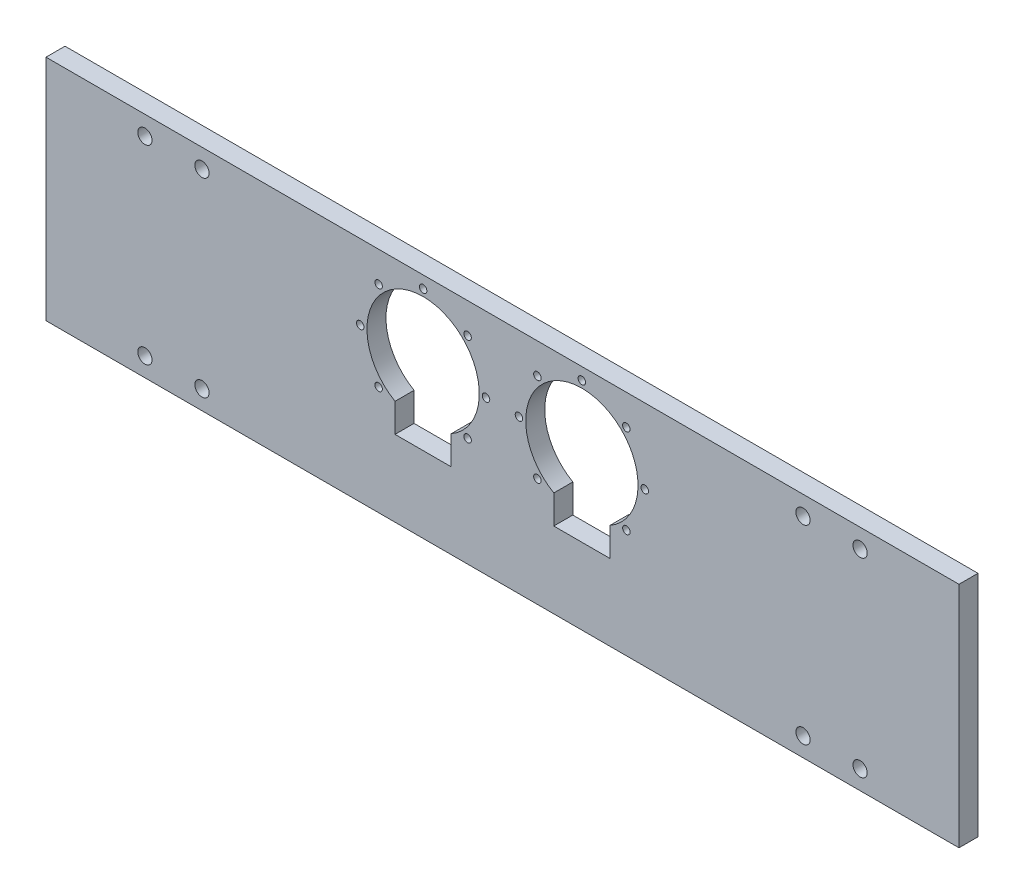
from build123d import *

# Parameters (mm, degrees)
SKETCH1_W           = 609.6
SKETCH1_H           = 152.4
SKETCH1_R           = 2.5
SKETCH1_R_2         = 4.7625
BOSS_EXTRUDE1_DEPTH = 12.7


with BuildPart() as part:
    # Sketch1 → Boss-Extrude1 (new body)
    with BuildSketch(Plane.XY):
        Rectangle(SKETCH1_W, SKETCH1_H)
        with Locations((53, 68.1999984)):
            Circle(SKETCH1_R, mode=Mode.SUBTRACT)
        with Locations((82.698486542, 55.898482492)):
            Circle(SKETCH1_R, mode=Mode.SUBTRACT)
        with Locations((95.00000245, 26.19999595)):
            Circle(SKETCH1_R, mode=Mode.SUBTRACT)
        with Locations((82.698486542, -3.498490592)):
            Circle(SKETCH1_R, mode=Mode.SUBTRACT)
        with Locations((23.301513458, -3.498490592)):
            Circle(SKETCH1_R, mode=Mode.SUBTRACT)
        with Locations((10.99999755, 26.19999595)):
            Circle(SKETCH1_R, mode=Mode.SUBTRACT)
        with Locations((23.301513458, 55.898482492)):
            Circle(SKETCH1_R, mode=Mode.SUBTRACT)
        with Locations((238.76, 63.5)):
            Circle(SKETCH1_R_2, mode=Mode.SUBTRACT)
        with Locations((200.66, 63.5)):
            Circle(SKETCH1_R_2, mode=Mode.SUBTRACT)
        with Locations((238.76, -63.5)):
            Circle(SKETCH1_R_2, mode=Mode.SUBTRACT)
        with Locations((200.66, -63.5)):
            Circle(SKETCH1_R_2, mode=Mode.SUBTRACT)
        with Locations((-82.698486542, -3.498490592)):
            Circle(SKETCH1_R, mode=Mode.SUBTRACT)
        with Locations((-95.00000245, 26.19999595)):
            Circle(SKETCH1_R, mode=Mode.SUBTRACT)
        with Locations((-82.698486542, 55.898482492)):
            Circle(SKETCH1_R, mode=Mode.SUBTRACT)
        with Locations((-53, 68.1999984)):
            Circle(SKETCH1_R, mode=Mode.SUBTRACT)
        with Locations((-23.301513458, 55.898482492)):
            Circle(SKETCH1_R, mode=Mode.SUBTRACT)
        with Locations((-10.99999755, 26.19999595)):
            Circle(SKETCH1_R, mode=Mode.SUBTRACT)
        with Locations((-23.301513458, -3.498490592)):
            Circle(SKETCH1_R, mode=Mode.SUBTRACT)
        with Locations((-238.76, 63.5)):
            Circle(SKETCH1_R_2, mode=Mode.SUBTRACT)
        with Locations((-200.66, 63.5)):
            Circle(SKETCH1_R_2, mode=Mode.SUBTRACT)
        with Locations((-200.66, -63.5)):
            Circle(SKETCH1_R_2, mode=Mode.SUBTRACT)
        with Locations((-238.76, -63.5)):
            Circle(SKETCH1_R_2, mode=Mode.SUBTRACT)
        with BuildLine():
            Line((34.25, -6.275954242), (34.25, -25.4))
            Line((34.25, -25.4), (71.75, -25.4))
            Line((71.75, -25.4), (71.75, -6.275954242))
            ThreePointArc((71.75, -6.275954242), (53, 63.6999984), (34.25, -6.275954242))
        make_face(mode=Mode.SUBTRACT)
        with BuildLine():
            Line((-34.25, -6.275954242), (-34.25, -25.4))
            Line((-34.25, -25.4), (-71.75, -25.4))
            Line((-71.75, -25.4), (-71.75, -6.275954242))
            ThreePointArc((-71.75, -6.275954242), (-53, 63.6999984), (-34.25, -6.275954242))
        make_face(mode=Mode.SUBTRACT)
    extrude(amount=BOSS_EXTRUDE1_DEPTH)


solid = part.part
